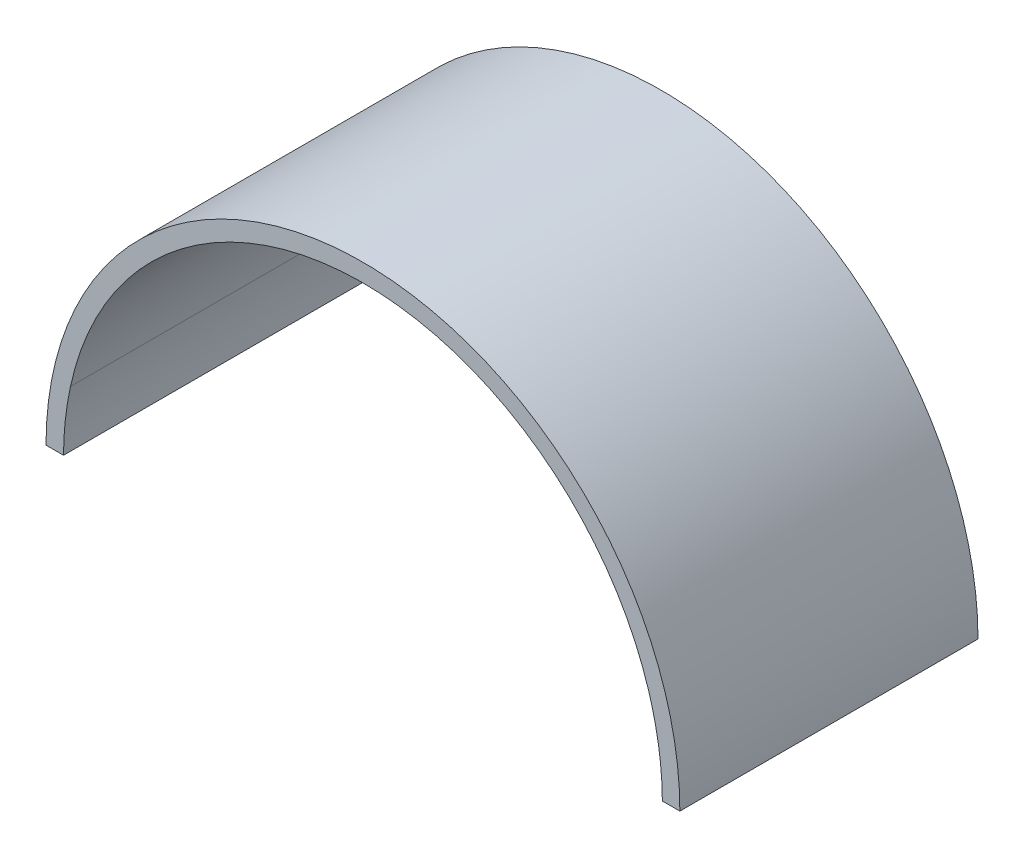
from build123d import *

# Parameters (mm, degrees)
BOSS_EXTRUDE1_DEPTH = 15
BOSS_EXTRUDE2_DEPTH = 15


with BuildPart() as part:
    # Sketch1 → Boss-Extrude1 (new, symmetric)
    with BuildSketch(Plane.XY):
        with BuildLine():
            Line((-31.891178344, 0), (-30.472178344, 0))
            ThreePointArc((-30.472178344, 0), (0, 30.472178344), (30.472178344, 0))
            Line((30.472178344, 0), (31.891178344, 0))
            ThreePointArc((31.891178344, 0), (0, 31.891178344), (-31.891178344, 0))
        make_face()
    extrude(amount=BOSS_EXTRUDE1_DEPTH, both=True)

    # Sketch2 → Boss-Extrude2 (add, symmetric)
    with BuildSketch(Plane.XY):
        with BuildLine():
            Line((-30.129278344, 0), (-30.472178344, 0))
            ThreePointArc((-30.472178344, 0), (0, 30.472178344), (30.472178344, 0))
            Line((30.472178344, 0), (30.129278344, 0))
            ThreePointArc((30.129278344, 0), (29.947091618, 3.193657531), (29.427339134, 6.35))
            add(Edge.make_bspline(
                [(29.427339134, 6.35), (24.299524612, 30.091178344), (0, 30.091178344), (-24.299524612, 30.091178344), (-29.427339134, 6.35)],
                knots=[0.212623764, 0.212623764, 0.212623764, 1.570796327, 1.570796327, 2.928968889, 2.928968889, 2.928968889], degree=2, weights=[1, 0.778146934, 1, 0.778146934, 1]))
            ThreePointArc((-29.427339134, 6.35), (-29.947091618, 3.193657531), (-30.129278344, 0))
        make_face()
    extrude(amount=BOSS_EXTRUDE2_DEPTH, both=True)


solid = part.part
